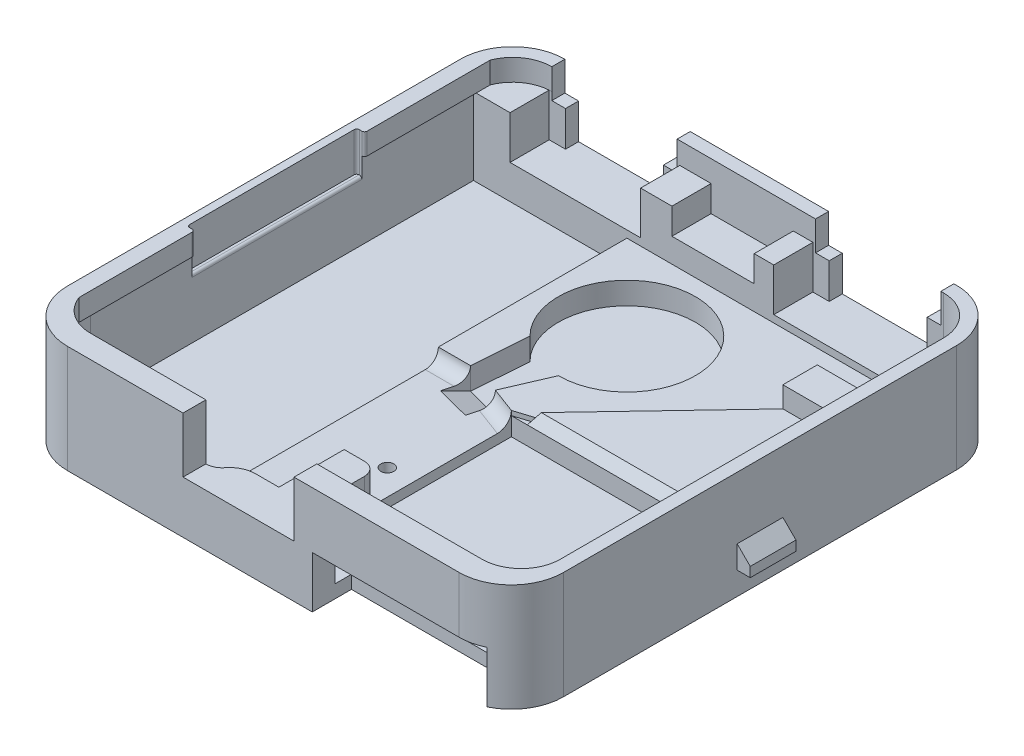
from build123d import *

# Parameters (mm, degrees)
SKETCH1_W                  = 38
SKETCH1_H                  = 37.1
BOSS_EXTRUDE1_DEPTH        = 8.25
FILLET1_R                  = 4
SHELL1_T                   = -1
SKETCH2_W                  = 13
SKETCH2_H                  = 3.95
CUT_EXTRUDE1_DEPTH         = 2
BOSS_EXTRUDE4_START        = 5.6
BOSS_EXTRUDE4_DEPTH        = 5.6
SKETCH8_W                  = 10
SKETCH8_H                  = 3
CUT_EXTRUDE3_DEPTH         = 3.3
CUT_EXTRUDE4_START         = -1
CUT_EXTRUDE4_DEPTH         = 1
SKETCH11_W                 = 6.3
SKETCH11_H                 = 3
CUT_EXTRUDE5_DEPTH         = 2
BOSS_EXTRUDE3_START        = 5.6
BOSS_EXTRUDE3_DEPTH        = 5.6
BOSS_EXTRUDE5_DEPTH        = 1.75
CUT_EXTRUDE6_DEPTH         = 1.7
CUT_EXTRUDE7_DEPTH         = 1.7
BOSS_EXTRUDE6_DEPTH        = 2.667169
SKETCH16_W                 = 3
SKETCH16_H                 = 3.85
BOSS_EXTRUDE7_DEPTH        = 3.163307
SKETCH17_W                 = 6.5
SKETCH17_H                 = 2.636696
BOSS_EXTRUDE8_DEPTH        = 2.05
CUT_EXTRUDE10_DEPTH        = 0.3
BOSS_EXTRUDE9_DEPTH        = 13.1
BOSS_EXTRUDE10_DEPTH       = 1.65
BOSS_EXTRUDE11_START       = -1.65
BOSS_EXTRUDE11_DEPTH       = 1.65
BOSS_EXTRUDE12_DEPTH       = 0.45
CUT_EXTRUDE11_DEPTH        = 0.35
BOSS_EXTRUDE13_REACH       = 55.042
SKETCH25_W                 = 8.5
SKETCH25_H                 = 4.25
CUT_EXTRUDE12_DEPTH        = 10
BOSS_EXTRUDE14_OUTLINE_W   = 1.4
BOSS_EXTRUDE14_OUTLINE_H   = 1
BOSS_EXTRUDE14_DEPTH       = 8.25
BOSS_EXTRUDE14_START       = 3.95
BOSS_EXTRUDE14_2_DEPTH     = 4.3
BOSS_EXTRUDE14_3_OUTLINE_W = 8.5
BOSS_EXTRUDE14_3_OUTLINE_H = 1
BOSS_EXTRUDE14_3_DEPTH     = 4
FILLET2_R                  = 4
CUT_EXTRUDE16_START        = 5
CUT_EXTRUDE16_DEPTH        = 9
FILLET4_R                  = 1
MOVE_START                 = 6.6
MOVE_FACE2_DEPTH           = 1.65
MOVE_START_2               = 0.7
MOVE_FACE2_2_DEPTH         = 5.9
CUT_EXTRUDE17_START        = -17.249619
CUT_EXTRUDE17_OUTLINE_W    = 7
CUT_EXTRUDE17_OUTLINE_H    = 1
CUT_EXTRUDE17_DEPTH        = 10.249619
CUT_EXTRUDE17_START_2      = -18.656177998
CUT_EXTRUDE17_2_OUTLINE_W  = 3.55
CUT_EXTRUDE17_2_OUTLINE_H  = 1
CUT_EXTRUDE17_2_DEPTH      = 16.656177998
CUT_EXTRUDE17_START_3      = 1.75
CUT_EXTRUDE17_3_DEPTH      = 7.25
CUT_EXTRUDE17_START_4      = 1
CUT_EXTRUDE17_4_OUTLINE_W  = 3
CUT_EXTRUDE17_4_OUTLINE_H  = 0.25
CUT_EXTRUDE17_4_DEPTH      = 3.95
CUT_EXTRUDE17_START_5      = 6.6
CUT_EXTRUDE17_5_DEPTH      = 2.4
FILLET5_R                  = 1
SKETCH3_W                  = 3.5
SKETCH3_H                  = 1.75
BOSS_EXTRUDE2_LIP_DEPTH    = 1
CUT_EXTRUDE2_LIP_DEPTH     = 3.5
SKETCH29_W                 = 0.6
SKETCH29_H                 = 13
CUT_EXTRUDE14_DEPTH        = 3
FILLET3_R                  = 0.2
CUT_EXTRUDE18_START        = -3.3
CUT_EXTRUDE18_DEPTH        = 3.3
CUT_EXTRUDE18_START_2      = -4.85
CUT_EXTRUDE18_2_DEPTH      = 1.55
CUT_EXTRUDE18_START_3      = -3.85
CUT_EXTRUDE18_3_OUTLINE_W  = 2
CUT_EXTRUDE18_3_OUTLINE_H  = 3.163307
CUT_EXTRUDE18_3_DEPTH      = 0.55
FILLET6_R                  = 2
SKETCH35_R                 = 0.5
CUT_EXTRUDE19_DEPTH        = 55.456152086


with BuildPart() as part:
    # Sketch1 → Boss-Extrude1 (new body)
    with BuildSketch(Plane(origin=(0, 0, 0), x_dir=(1, 0, 0), z_dir=(0, 1, 0))):
        with Locations((19, 18.55)):
            Rectangle(SKETCH1_W, SKETCH1_H)
    extrude(amount=BOSS_EXTRUDE1_DEPTH)

    # Fillet1
    fillet1_edges = [part.edges().sort_by_distance(p)[0] for p in [
        (0, 4.125, 0),
        (0, 4.125, -37.1),
        (38, 4.125, -37.1),
        (38, 4.125, 0),
    ]]
    fillet(fillet1_edges, radius=FILLET1_R)

    # Shell1
    shell1_openings = [part.faces().sort_by_distance(p)[0] for p in [
        (19, 8.25, -18.55),
    ]]
    offset(amount=SHELL1_T, openings=shell1_openings, kind=Kind.INTERSECTION)

    # Sketch2 → Cut-Extrude1 (cut)
    with BuildSketch(Plane.XY):
        with Locations((29.25, 1.975)):
            Rectangle(SKETCH2_W, SKETCH2_H)
    extrude(amount=-CUT_EXTRUDE1_DEPTH, mode=Mode.SUBTRACT)

    # Sketch7 → Boss-Extrude4 (add)
    with BuildSketch(Plane(origin=(0, 1, 0), x_dir=(1, 0, 0), z_dir=(0, 1, 0)).offset(BOSS_EXTRUDE4_START)):
        with BuildLine():
            Line((37, 33.1), (1, 33.1))
            ThreePointArc((1, 33.1), (1.878679656, 35.221320344), (4, 36.1))
            Line((4, 36.1), (34, 36.1))
            ThreePointArc((34, 36.1), (36.121320344, 35.221320344), (37, 33.1))
        make_face()
    extrude(amount=-BOSS_EXTRUDE4_DEPTH)

    # Sketch8 → Cut-Extrude3 (cut)
    with BuildSketch(Plane(origin=(0, 6.6, 0), x_dir=(1, 0, 0), z_dir=(0, 1, 0))):
        with Locations((8.8, 34.6)):
            Rectangle(SKETCH8_W, SKETCH8_H)
        with Locations((29, 34.6)):
            Rectangle(SKETCH8_W, SKETCH8_H)
    extrude(amount=-CUT_EXTRUDE3_DEPTH, mode=Mode.SUBTRACT)

    # Sketch9 → Cut-Extrude4 (cut)
    with BuildSketch(Plane.XY.offset(-36.1).offset(CUT_EXTRUDE4_START)):
        Polygon((4, 8.25), (13.6, 8.25), (13.6, 6), (12.55, 6), (12.55, 3.3), (5.05, 3.3), (5.05, 6), (4, 6), align=None)
        Polygon((24.2, 8.25), (33.8, 8.25), (33.8, 6), (32.75, 6), (32.75, 3.3), (25.25, 3.3), (25.25, 6), (24.2, 6), align=None)
    extrude(amount=CUT_EXTRUDE4_DEPTH, mode=Mode.SUBTRACT)

    # Sketch11 → Cut-Extrude5 (cut)
    with BuildSketch(Plane(origin=(0, 6.6, 0), x_dir=(1, 0, 0), z_dir=(0, 1, 0))):
        with Locations((19.35, 34.6)):
            Rectangle(SKETCH11_W, SKETCH11_H)
    extrude(amount=-CUT_EXTRUDE5_DEPTH, mode=Mode.SUBTRACT)

    # Sketch6 → Boss-Extrude3 (add)
    with BuildSketch(Plane(origin=(0, 1, 0), x_dir=(1, 0, 0), z_dir=(0, 1, 0)).offset(BOSS_EXTRUDE3_START)):
        with BuildLine():
            Line((19.75, 1), (19.75, 2))
            Line((19.75, 2), (1.763932023, 2))
            ThreePointArc((1.763932023, 2), (2.775255129, 1.261387212), (4, 1))
            Line((4, 1), (19.75, 1))
        make_face()
    extrude(amount=-BOSS_EXTRUDE3_DEPTH)

    # Sketch12 → Boss-Extrude5 (add)
    with BuildSketch(Plane(origin=(0, 1, 0), x_dir=(1, 0, 0), z_dir=(0, 1, 0))):
        Polygon((19.75, 2), (12.75, 2), (12.75, 33.1), (20.95127, 33.1), (37, 33.1), (37, 17.249619), (19.75, 17.249619), align=None)
    extrude(amount=BOSS_EXTRUDE5_DEPTH)

    # Sketch13 → Cut-Extrude6 (cut)
    with BuildSketch(Plane(origin=(0, 2.75, 0), x_dir=(1, 0, 0), z_dir=(0, 1, 0))):
        with BuildLine():
            Line((19.25, 21.35), (17.7974, 17.979848615))
            Line((17.7974, 17.979848615), (15.217406, 18.656177998))
            Line((15.217406, 18.656177998), (15.537535, 22.887843804))
            ThreePointArc((15.537535, 22.887843804), (21.259188887, 31.450325764), (19.25, 21.35))
        make_face()
    extrude(amount=-CUT_EXTRUDE6_DEPTH, mode=Mode.SUBTRACT)

    # Sketch14 → Cut-Extrude7 (cut)
    with BuildSketch(Plane(origin=(0, 2.75, 0), x_dir=(1, 0, 0), z_dir=(0, 1, 0))):
        Polygon((17.7974, 17.979848615), (16.639426045, 13.562524853), (14.059432045, 14.238854236), (15.217406, 18.656177998), align=None)
    extrude(amount=-CUT_EXTRUDE7_DEPTH, mode=Mode.SUBTRACT)

    # Sketch15 → Boss-Extrude6 (add)
    with BuildSketch(Plane(origin=(12.242778562, 0, 3.209368267), x_dir=(-0.2535757513526772, 0, 0.9673155319366713), z_dir=(-0.9673155319366713, 0, -0.2535757513526772))):
        Polygon((-17.338595904, 2.75), (-17.338595904, 1.05), (-21.905175904, 1.05), align=None)
    extrude(amount=BOSS_EXTRUDE6_DEPTH)

    # Sketch16 → Boss-Extrude7 (add)
    with BuildSketch(Plane.XY.offset(-33.1)):
        with Locations((35.5, 4.675)):
            Rectangle(SKETCH16_W, SKETCH16_H)
    extrude(amount=BOSS_EXTRUDE7_DEPTH)

    # Sketch17 → Boss-Extrude8 (add)
    with BuildSketch(Plane(origin=(0, 2.75, 0), x_dir=(1, 0, 0), z_dir=(0, 1, 0))):
        with Locations((33.75, 28.618345)):
            Rectangle(SKETCH17_W, SKETCH17_H)
    extrude(amount=BOSS_EXTRUDE8_DEPTH)

    # Sketch18 → Cut-Extrude10 (cut)
    with BuildSketch(Plane(origin=(0, 1, 0), x_dir=(1, 0, 0), z_dir=(0, 1, 0))):
        with BuildLine():
            Line((12.75, 2), (1.763932023, 2))
            ThreePointArc((1.763932023, 2), (1.197482923, 2.929533731), (1, 4))
            Line((1, 4), (1, 33.1))
            Line((1, 33.1), (12.75, 33.1))
            Line((12.75, 33.1), (12.75, 2))
        make_face()
    extrude(amount=-CUT_EXTRUDE10_DEPTH, mode=Mode.SUBTRACT)

    # Sketch19 → Boss-Extrude9 (add)
    with BuildSketch(Plane(origin=(0, 0, -2), x_dir=(-1, 0, 0), z_dir=(0, 0, -1))):
        Polygon((-19.75, 2.75), (-19.75, 4.85), (-17.8, 4.85), (-16.3, 2.75), align=None)
    extrude(amount=BOSS_EXTRUDE9_DEPTH)

    # Sketch20 → Boss-Extrude10 (add)
    with BuildSketch(Plane(origin=(0, 8.25, 0), x_dir=(1, 0, 0), z_dir=(0, 1, 0))):
        with BuildLine():
            Line((1.2, 2.922967039), (1.2, 34.177032961))
            ThreePointArc((1.2, 34.177032961), (1.050423759, 33.647722558), (1, 33.1))
            Line((1, 33.1), (1, 4))
            ThreePointArc((1, 4), (1.050423759, 3.452277442), (1.2, 2.922967039))
        make_face()
    extrude(amount=-BOSS_EXTRUDE10_DEPTH)

    # Sketch21 → Boss-Extrude11 (add)
    with BuildSketch(Plane(origin=(0, 8.25, 0), x_dir=(1, 0, 0), z_dir=(0, 1, 0)).offset(BOSS_EXTRUDE11_START)):
        with BuildLine():
            Line((34, 1), (37, 5))
            Line((37, 5), (37, 4))
            ThreePointArc((37, 4), (36.121320344, 1.878679656), (34, 1))
        make_face()
    extrude(amount=-BOSS_EXTRUDE11_DEPTH)

    # Sketch22 → Boss-Extrude12 (add)
    with BuildSketch(Plane(origin=(0, 2.75, 0), x_dir=(1, 0, 0), z_dir=(0, 1, 0))):
        Polygon((37, 27.299997), (37, 17.799684), (21.494559, 17.799684), (30.5, 27.299997), align=None)
    extrude(amount=BOSS_EXTRUDE12_DEPTH)

    # Sketch23 → Cut-Extrude11 (cut)
    with BuildSketch(Plane(origin=(0, 2.75, 0), x_dir=(1, 0, 0), z_dir=(0, 1, 0))):
        Polygon((37, 17.799684), (37, 17.249619), (19.75, 17.249619), (21.494559, 17.799684), align=None)
    extrude(amount=-CUT_EXTRUDE11_DEPTH, mode=Mode.SUBTRACT)

    # Boss-Extrude13: up to this plane
    boss_extrude13_end = Plane(origin=(21.494559, 3.2, -17.799684), z_dir=(0.7257564405967974, 0, 0.6879517344496395))
    # Sketch24 → Boss-Extrude13 (add, up to the surface)
    with BuildSketch(Plane.ZY.offset(-37), mode=Mode.PRIVATE) as boss_extrude13_sk1:
        Polygon((-17.799684, 3.2), (-17.249619, 2.4), (-17.799684, 2.4), align=None)
    boss_extrude13_tool1 = split(extrude(boss_extrude13_sk1.sketch, amount=BOSS_EXTRUDE13_REACH, mode=Mode.PRIVATE), bisect_by=boss_extrude13_end, keep=Keep.BOTH, mode=Mode.PRIVATE)
    add(boss_extrude13_tool1.solids().sort_by_distance((37, 2.666667, -17.616329))[0])

    # Sketch25 → Cut-Extrude12 (cut)
    with BuildSketch(Plane.XY):
        with Locations((17.1, 6.125)):
            Rectangle(SKETCH25_W, SKETCH25_H)
    extrude(amount=-CUT_EXTRUDE12_DEPTH, mode=Mode.SUBTRACT)

    # Boss-Extrude14: read off the stored shape, not the designer's step
    # Boss-Extrude14 outline → Boss-Extrude14 (add)
    with BuildSketch(Plane(origin=(0, 0, 0), x_dir=(1, 0, 0), z_dir=(0, 1, 0))):
        with BuildLine():
            Line((38, -1), (38, 4))
            ThreePointArc((38, 4), (37.391164992, 1.878679656), (35.75, 0.403126357))
            Line((35.75, 0.403126357), (35.75, -1))
            Line((35.75, -1), (38, -1))
        make_face()
        with Locations((22.05, -0.5)):
            Rectangle(BOSS_EXTRUDE14_OUTLINE_W, BOSS_EXTRUDE14_OUTLINE_H)
        with BuildLine():
            Line((0, -1), (12.85, -1))
            Line((12.85, -1), (12.85, 0))
            Line((12.85, 0), (4, 0))
            ThreePointArc((4, 0), (1.171572875, 1.171572875), (0, 4))
            Line((0, 4), (0, -1))
        make_face()
    extrude(amount=BOSS_EXTRUDE14_DEPTH)

    # Boss-Extrude14 2 outline → Boss-Extrude14 2 (add)
    with BuildSketch(Plane(origin=(0, 0, 0), x_dir=(1, 0, 0), z_dir=(0, 1, 0)).offset(BOSS_EXTRUDE14_START)):
        with BuildLine():
            Line((35.75, -1), (35.75, 0.403126357))
            ThreePointArc((35.75, 0.403126357), (34.897915762, 0.102084238), (34, 0))
            Line((34, 0), (22.75, 0))
            Line((22.75, 0), (22.75, -1))
            Line((22.75, -1), (35.75, -1))
        make_face()
    extrude(amount=BOSS_EXTRUDE14_2_DEPTH)

    # Boss-Extrude14 3 outline → Boss-Extrude14 3 (add)
    with BuildSketch(Plane(origin=(0, 0, 0), x_dir=(1, 0, 0), z_dir=(0, 1, 0))):
        with Locations((17.1, -0.5)):
            Rectangle(BOSS_EXTRUDE14_3_OUTLINE_W, BOSS_EXTRUDE14_3_OUTLINE_H)
    extrude(amount=BOSS_EXTRUDE14_3_DEPTH)

    # Fillet2
    fillet2_edges = [part.edges().sort_by_distance(p)[0] for p in [
        (0, 4.125, 1),
        (38, 4.125, 1),
    ]]
    fillet(fillet2_edges, radius=FILLET2_R)

    # Sketch19<2> → Cut-Extrude16 (cut)
    with BuildSketch(Plane(origin=(0, 0, -2), x_dir=(-1, 0, 0), z_dir=(0, 0, -1)).offset(CUT_EXTRUDE16_START)):
        Polygon((-19.75, 2.75), (-19.75, 4.85), (-17.8, 4.85), (-16.3, 2.75), align=None)
    extrude(amount=CUT_EXTRUDE16_DEPTH, mode=Mode.SUBTRACT)

    # Fillet4
    fillet4_edges = [part.edges().sort_by_distance(p)[0] for p in [
        (19.75, 3.375, -7),
    ]]
    fillet(fillet4_edges, radius=FILLET4_R)

    # Move Face2: read off the stored shape, not the designer's step
    # Move Face2 outline → Move Face2 (cut)
    with BuildSketch(Plane(origin=(0, 0, 0), x_dir=(1, 0, 0), z_dir=(0, 1, 0)).offset(MOVE_START)):
        with BuildLine():
            Line((4, 0.75), (12.85, 0.75))
            Line((12.85, 0.75), (12.85, 1))
            Line((12.85, 1), (4, 1))
            ThreePointArc((4, 1), (2.301632973, 1.527036304), (1.199999999, 2.922967039))
            Line((1.199999999, 2.922967039), (1.199999999, 2.672967039))
            ThreePointArc((1.199999999, 2.672967039), (2.301632973, 1.277036304), (4, 0.75))
        make_face()
    extrude(amount=MOVE_FACE2_DEPTH, mode=Mode.SUBTRACT)

    # Move Face2 2 outline → Move Face2 2 (cut)
    with BuildSketch(Plane(origin=(0, 0, 0), x_dir=(1, 0, 0), z_dir=(0, 1, 0)).offset(MOVE_START_2)):
        with BuildLine():
            Line((1.563301413, 2), (1.763932022, 1.999999999))
            ThreePointArc((1.763932022, 1.999999999), (1.197482923, 2.92953373), (1, 4))
            Line((1, 4), (1, 3.75))
            ThreePointArc((1, 3.75), (1.144295554, 2.830787228), (1.563301413, 2))
        make_face()
    extrude(amount=MOVE_FACE2_2_DEPTH, mode=Mode.SUBTRACT)

    # Cut-Extrude17: read off the stored shape, not the designer's step
    # Cut-Extrude17 outline → Cut-Extrude17 (cut)
    with BuildSketch(Plane.XY.offset(CUT_EXTRUDE17_START)):
        with Locations((16.25, 2.25)):
            Rectangle(CUT_EXTRUDE17_OUTLINE_W, CUT_EXTRUDE17_OUTLINE_H)
    extrude(amount=CUT_EXTRUDE17_DEPTH, mode=Mode.SUBTRACT)

    # Cut-Extrude17 2 outline → Cut-Extrude17 2 (cut)
    with BuildSketch(Plane.XY.offset(CUT_EXTRUDE17_START_2)):
        with Locations((14.525, 2.25)):
            Rectangle(CUT_EXTRUDE17_2_OUTLINE_W, CUT_EXTRUDE17_2_OUTLINE_H)
    extrude(amount=CUT_EXTRUDE17_2_DEPTH, mode=Mode.SUBTRACT)

    # Cut-Extrude17 3 outline → Cut-Extrude17 3 (cut)
    with BuildSketch(Plane(origin=(0, 0, 0), x_dir=(1, 0, 0), z_dir=(0, 1, 0)).offset(CUT_EXTRUDE17_START_3)):
        Polygon((17.605974847, 17.249619), (19.75, 17.249619), (17.7974, 17.979848615), align=None)
        Polygon((33.8125, 0.75), (34, 1), (19.75, 1), (19.75, 0.75), align=None)
        with BuildLine():
            ThreePointArc((18.75, 7), (19.457106781, 6.707106781), (19.75, 6))
            Line((19.75, 6), (19.75, 7))
            Line((19.75, 7), (18.75, 7))
        make_face()
    extrude(amount=CUT_EXTRUDE17_3_DEPTH, mode=Mode.SUBTRACT)

    # Cut-Extrude17 4 outline → Cut-Extrude17 4 (cut)
    with BuildSketch(Plane(origin=(0, 0, 0), x_dir=(1, 0, 0), z_dir=(0, 1, 0)).offset(CUT_EXTRUDE17_START_4)):
        with BuildLine():
            Line((33.8125, 0.75), (34, 0.75))
            ThreePointArc((34, 0.75), (36.121320344, 1.628679656), (37, 3.75))
            Line((37, 3.75), (37, 4))
            ThreePointArc((37, 4), (36.121320344, 1.878679656), (34, 1))
            Line((34, 1), (33.8125, 0.75))
        make_face()
        with Locations((21.25, 0.875)):
            Rectangle(CUT_EXTRUDE17_4_OUTLINE_W, CUT_EXTRUDE17_4_OUTLINE_H)
    extrude(amount=CUT_EXTRUDE17_4_DEPTH, mode=Mode.SUBTRACT)

    # Cut-Extrude17 5 outline → Cut-Extrude17 5 (cut)
    with BuildSketch(Plane(origin=(0, 0, 0), x_dir=(1, 0, 0), z_dir=(0, 1, 0)).offset(CUT_EXTRUDE17_START_5)):
        with BuildLine():
            Line((33.8125, 0.75), (34, 0.75))
            ThreePointArc((34, 0.75), (36.121320344, 1.628679656), (37, 3.75))
            Line((37, 3.75), (37, 4))
            ThreePointArc((37, 4), (36.121320344, 1.878679656), (34, 1))
            Line((34, 1), (33.8125, 0.75))
        make_face()
    extrude(amount=CUT_EXTRUDE17_5_DEPTH, mode=Mode.SUBTRACT)

    # Fillet5
    # the kernel refuses this fillet: 1 mm, written as the material it adds along each edge
    with BuildSketch(Plane(origin=(12.75, 1.75, -18.656177998), x_dir=(0, 1, 0), z_dir=(1, 0, 0))) as fillet5_piece_1_section:
        with BuildLine():
            CenterArc((FILLET5_R, FILLET5_R), FILLET5_R, 180, 90)
            Line((0, FILLET5_R), (0, 0))
            Line((0, 0), (FILLET5_R, 0))
        make_face()
    fillet5_piece_1 = extrude(amount=4.967406, mode=Mode.PRIVATE)
    fillet5_piece_1 = split(fillet5_piece_1, bisect_by=Plane(origin=(15.058750162, 1.75, -18.0509535), z_dir=(-0.9673155319366713, 0, -0.25357575135267735)), keep=Keep.TOP, mode=Mode.PRIVATE)
    fillet5_piece_1 = split(fillet5_piece_1, bisect_by=Plane(origin=(15.203365275, 1.75, -18.470578896), z_dir=(-0.9971507006944014, 0, -0.07543527095904363)), keep=Keep.TOP, mode=Mode.PRIVATE)
    add(fillet5_piece_1)
    with BuildSketch(Plane(origin=(12.75, 1.75, -18.656177998), x_dir=(0, 1, 0), z_dir=(1, 0, 0))) as fillet5_piece_2_section:
        with BuildLine():
            CenterArc((FILLET5_R, FILLET5_R), FILLET5_R, 180, 90)
            Line((0, FILLET5_R), (0, 0))
            Line((0, 0), (FILLET5_R, 0))
        make_face()
    fillet5_piece_2 = extrude(amount=4.967406, mode=Mode.PRIVATE)
    fillet5_piece_2 = split(fillet5_piece_2, bisect_by=Plane(origin=(17.638744162, 1.75, -17.374624117), z_dir=(0.9673155319366713, 0, 0.25357575135267696)), keep=Keep.TOP, mode=Mode.PRIVATE)
    add(fillet5_piece_2)
    with BuildSketch(Plane(origin=(22.091608716, 1.75, -16.373908649), x_dir=(0, 1, 0), z_dir=(-0.9366434865859224, 0, -0.35028414042911915))) as fillet5_piece_3_section:
        with BuildLine():
            CenterArc((FILLET5_R, -FILLET5_R), FILLET5_R, 90, 90)
            Line((0, -FILLET5_R), (0, 0))
            Line((0, 0), (FILLET5_R, 0))
        make_face()
    fillet5_piece_3 = extrude(amount=7.084677925, mode=Mode.PRIVATE)
    fillet5_piece_3 = split(fillet5_piece_3, bisect_by=Plane(origin=(21.628719501, 1.75, -17.841985233), z_dir=(0.30070960850054823, 0, 0.9537157497679521)), keep=Keep.TOP, mode=Mode.PRIVATE)
    fillet5_piece_3 = split(fillet5_piece_3, bisect_by=Plane(origin=(19.75, 1.75, -16.373908649), z_dir=(-1, 0, 0)), keep=Keep.TOP, mode=Mode.PRIVATE)
    add(fillet5_piece_3)
    with BuildSketch(Plane(origin=(22.091608716, 1.75, -16.373908649), x_dir=(0, 1, 0), z_dir=(-0.9366434865859224, 0, -0.35028414042911915))) as fillet5_piece_4_section:
        with BuildLine():
            CenterArc((FILLET5_R, -FILLET5_R), FILLET5_R, 90, 90)
            Line((0, -FILLET5_R), (0, 0))
            Line((0, 0), (FILLET5_R, 0))
        make_face()
    fillet5_piece_4 = extrude(amount=7.084677925, mode=Mode.PRIVATE)
    fillet5_piece_4 = split(fillet5_piece_4, bisect_by=Plane(origin=(22.091608716, 1.75, -17.249619), z_dir=(0, 0, 1)), keep=Keep.TOP, mode=Mode.PRIVATE)
    fillet5_piece_4 = split(fillet5_piece_4, bisect_by=Plane(origin=(21.628719501, 1.75, -17.841985233), z_dir=(-0.30070960850054823, 0, -0.9537157497679521)), keep=Keep.TOP, mode=Mode.PRIVATE)
    fillet5_piece_4 = split(fillet5_piece_4, bisect_by=Plane(origin=(17.67960304, 1.75, -17.5304885), z_dir=(0.9673155319366713, 0, 0.25357575135267696)), keep=Keep.TOP, mode=Mode.PRIVATE)
    add(fillet5_piece_4)
    with BuildSketch(Plane(origin=(22.091608716, 1.75, -16.373908649), x_dir=(0, 1, 0), z_dir=(-0.9366434865859224, 0, -0.35028414042911915))) as fillet5_piece_5_section:
        with BuildLine():
            CenterArc((FILLET5_R, -FILLET5_R), FILLET5_R, 90, 90)
            Line((0, -FILLET5_R), (0, 0))
            Line((0, 0), (FILLET5_R, 0))
        make_face()
    fillet5_piece_5 = extrude(amount=7.084677925, mode=Mode.PRIVATE)
    fillet5_piece_5 = split(fillet5_piece_5, bisect_by=Plane(origin=(22.091608716, 1.75, -17.249619), z_dir=(0, 0, -1)), keep=Keep.TOP, mode=Mode.PRIVATE)
    fillet5_piece_5 = split(fillet5_piece_5, bisect_by=Plane(origin=(17.886435794, 1.75, -18.186418975), z_dir=(0.9183291832878407, 0, 0.3958175225048627)), keep=Keep.TOP, mode=Mode.PRIVATE)
    fillet5_piece_5 = split(fillet5_piece_5, bisect_by=Plane(origin=(17.67960304, 1.75, -17.5304885), z_dir=(0.9673155319366713, 0, 0.25357575135267696)), keep=Keep.TOP, mode=Mode.PRIVATE)
    fillet5_piece_5 = split(fillet5_piece_5, bisect_by=Plane(origin=(19.75, 1.75, -16.373908649), z_dir=(-1, 0, 0)), keep=Keep.TOP, mode=Mode.PRIVATE)
    add(fillet5_piece_5)

    # Sketch3 → Boss-Extrude2-LIP (add)
    with BuildSketch(Plane(origin=(38, 0, 0), x_dir=(0, 0, -1), z_dir=(1, 0, 0))):
        with Locations((18.05, 2.625)):
            Rectangle(SKETCH3_W, SKETCH3_H)
    boss_extrude2_lip = extrude(amount=BOSS_EXTRUDE2_LIP_DEPTH)

    # Sketch4 → Cut-Extrude2-LIP (cut)
    with BuildSketch(Plane(origin=(0, 0, -19.8), x_dir=(-1, 0, 0), z_dir=(0, 0, -1))):
        Polygon((-38, 3.5), (-39, 3.5), (-39, 2.5), align=None)
    cut_extrude2_lip = extrude(amount=-CUT_EXTRUDE2_LIP_DEPTH, mode=Mode.SUBTRACT)

    # Mirror1: Boss-Extrude2-LIP, Cut-Extrude2-LIP across plane
    add(boss_extrude2_lip.mirror(Plane(origin=(19, 0, 0), x_dir=(0, 0, 1), z_dir=(1, 0, 0))))
    add(cut_extrude2_lip.mirror(Plane(origin=(19, 0, 0), x_dir=(0, 0, 1), z_dir=(1, 0, 0))), mode=Mode.SUBTRACT)

    # Sketch29 → Cut-Extrude14 (cut)
    with BuildSketch(Plane(origin=(0, 8.25, 0), x_dir=(1, 0, 0), z_dir=(0, 1, 0))):
        with Locations((0.9, 18.05)):
            Rectangle(SKETCH29_W, SKETCH29_H)
    extrude(amount=-CUT_EXTRUDE14_DEPTH, mode=Mode.SUBTRACT)

    # Fillet3
    fillet3_edges = [part.edges().sort_by_distance(p)[0] for p in [
        (0.6, 6.75, -11.55),
        (1.2, 7.425, -11.55),
        (0.6, 6.75, -24.55),
        (1.2, 7.425, -24.55),
        (1, 5.25, -18.05),
    ]]
    fillet(fillet3_edges, radius=FILLET3_R - 0.0001)  # a hair under: the kernel refuses the full size

    # Cut-Extrude18: read off the stored shape, not the designer's step
    # Cut-Extrude18 outline → Cut-Extrude18 (cut)
    with BuildSketch(Plane(origin=(0, 6.6, 0), x_dir=(1, 0, 0), z_dir=(0, 1, 0)).offset(CUT_EXTRUDE18_START)):
        with BuildLine():
            Line((14.1, 2), (7.156650707, 2))
            Line((7.156650707, 2), (7.156650707, 0.75))
            Line((7.156650707, 0.75), (12.85, 0.75))
            ThreePointArc((12.85, 0.75), (13.733883476, 1.116116524), (14.1, 2))
        make_face()
        with BuildLine():
            Line((36, 29.936693), (36.000000001, 35.336067978))
            ThreePointArc((36.000000001, 35.336067978), (35.07046627, 35.902517077), (34, 36.1))
            Line((34, 36.1), (34, 29.936693))
            Line((34, 29.936693), (36, 29.936693))
        make_face()
    extrude(amount=CUT_EXTRUDE18_DEPTH, mode=Mode.SUBTRACT)

    # Cut-Extrude18 2 outline → Cut-Extrude18 2 (cut)
    with BuildSketch(Plane(origin=(0, 6.6, 0), x_dir=(1, 0, 0), z_dir=(0, 1, 0)).offset(CUT_EXTRUDE18_START_2)):
        with BuildLine():
            Line((14.1, 2), (7.156650707, 2))
            Line((7.156650707, 2), (7.156650707, 0.75))
            Line((7.156650707, 0.75), (12.85, 0.75))
            ThreePointArc((12.85, 0.75), (13.733883476, 1.116116524), (14.1, 2))
        make_face()
    extrude(amount=CUT_EXTRUDE18_2_DEPTH, mode=Mode.SUBTRACT)

    # Cut-Extrude18 3 outline → Cut-Extrude18 3 (cut)
    with BuildSketch(Plane(origin=(0, 6.6, 0), x_dir=(1, 0, 0), z_dir=(0, 1, 0)).offset(CUT_EXTRUDE18_START_3)):
        with Locations((35, 31.5183465)):
            Rectangle(CUT_EXTRUDE18_3_OUTLINE_W, CUT_EXTRUDE18_3_OUTLINE_H)
    extrude(amount=CUT_EXTRUDE18_3_DEPTH, mode=Mode.SUBTRACT)

    # Fillet6
    # the kernel refuses this fillet: 2 mm, written as the material it adds along each edge
    with BuildSketch(Plane(origin=(7.156650707, -2.885124054, -0.75), x_dir=(0, 0, -1), z_dir=(0, 1, 0))) as fillet6_piece_1_section:
        with BuildLine():
            CenterArc((2, -1.854049622), FILLET6_R, 112.024312837, 67.975687163)
            Line((0, -1.854049622), (0, 0))
            Line((0, 0), (1.25, 0))
        make_face()
    fillet6_piece_1 = extrude(amount=9.485124054, mode=Mode.PRIVATE)
    fillet6_piece_1 = split(fillet6_piece_1, bisect_by=Plane(origin=(7.156650707, 0.7, -0.75), z_dir=(0, 1, 0)), keep=Keep.TOP, mode=Mode.PRIVATE)
    add(fillet6_piece_1)
    # the kernel refuses this fillet: 2 mm, written as the material it takes off along each edge
    with BuildSketch(Plane(origin=(14.1, 7.279344227, -2), x_dir=(1, 0, 0), z_dir=(0, -1, 0))) as fillet6_2_piece_1:
        with BuildLine():
            CenterArc((1.311737691, 2), FILLET6_R, 217.979872459, 52.020127541)
            ThreePointArc((-0.264716273, 0.769230769), (-0.068030318, 0.406752591), (0, 0))
            Line((0, 0), (1.311737691, 0))
        make_face()
    extrude(amount=5.529344227, mode=Mode.SUBTRACT)

    # Sketch35 → Cut-Extrude19 (cut, through all)
    with BuildSketch(Plane.XZ):
        with Locations(Location((17.8, -9.7, 0), (0, 0, 270))):
            Circle(SKETCH35_R)
    extrude(amount=-CUT_EXTRUDE19_DEPTH, mode=Mode.SUBTRACT)


solid = part.part
